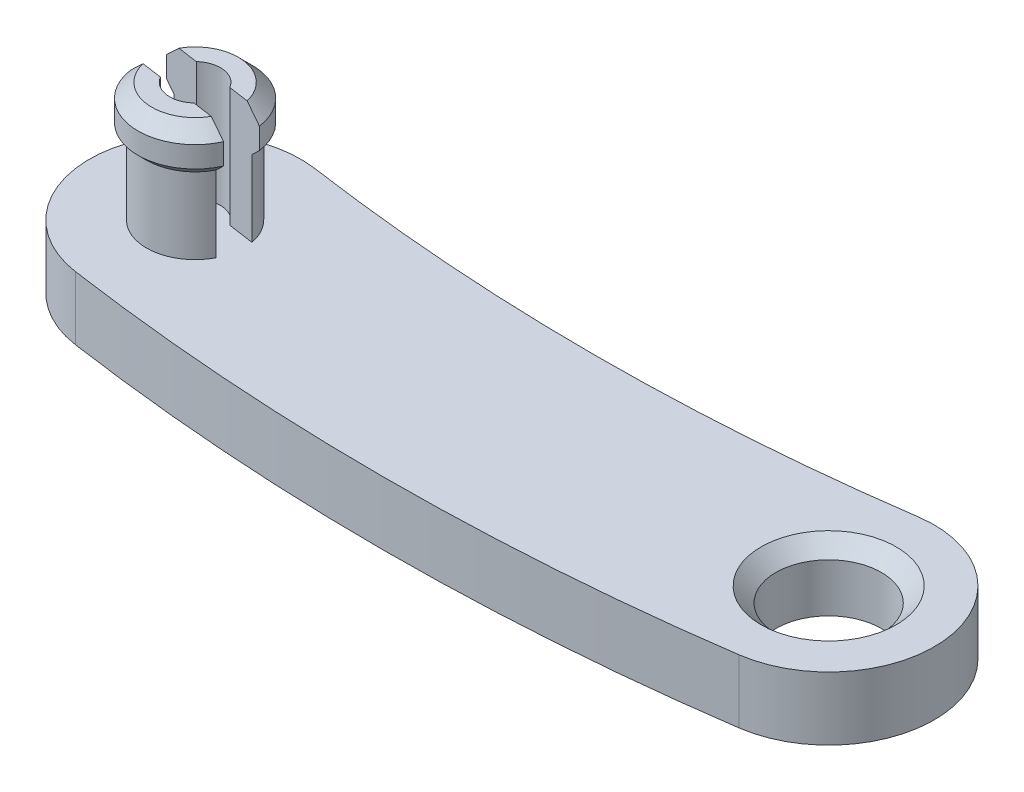
from build123d import *

# Parameters (mm, degrees)
SKETCH1_R           = 5
BOSS_EXTRUDE1_DEPTH = 3
SKETCH2_R           = 2.5
CUT_EXTRUDE1_DEPTH  = 3
CHAMFER1_SIZE       = 0.7
SKETCH3_R           = 2.3
BOSS_EXTRUDE2_DEPTH = 4
SKETCH4_R           = 2.7
BOSS_EXTRUDE3_DEPTH = 1
CHAMFER2_SIZE       = 0.4
SKETCH5_R           = 2.05
BOSS_EXTRUDE4_DEPTH = 0.65
CHAMFER3_SIZE       = 0.65
CUT_EXTRUDE2_REACH  = 38.562
SKETCH7_R           = 1.2
CUT_EXTRUDE3_DEPTH  = 5.65


with BuildPart() as part:
    # Sketch1 → Boss-Extrude1 (new body)
    with BuildSketch(Plane(origin=(0, 0, 0), x_dir=(1, 0, 0), z_dir=(0, 1, 0))):
        with Locations((-30, 0)):
            Circle(SKETCH1_R)
        with BuildLine():
            ThreePointArc((0.714285714, -4.948716593), (-4.948716593, -0.714285714), (-0.714285714, 4.948716593))
            ThreePointArc((-0.714285714, 4.948716593), (-15, 3.923048454), (-29.285714286, 4.948716593))
            ThreePointArc((-29.285714286, 4.948716593), (-26.22035527, 3.273268354), (-25, 0))
            ThreePointArc((-25, 0), (-26.726731646, -3.77964473), (-30.714285714, -4.948716593))
            ThreePointArc((-30.714285714, -4.948716593), (-15, -6.076951546), (0.714285714, -4.948716593))
        make_face()
        Circle(SKETCH1_R)
    extrude(amount=-BOSS_EXTRUDE1_DEPTH)

    # Sketch2 → Cut-Extrude1 (cut)
    with BuildSketch(Plane(origin=(0, 0, 0), x_dir=(1, 0, 0), z_dir=(0, 1, 0))):
        with Locations(Location((0, 0, 0), (0, 0, 270))):
            Circle(SKETCH2_R)
    extrude(amount=-CUT_EXTRUDE1_DEPTH, mode=Mode.SUBTRACT)

    # Chamfer1
    chamfer1_edges = [part.edges().sort_by_distance(p)[0] for p in [
        (0, 0, -2.5),
    ]]
    chamfer(chamfer1_edges, length=CHAMFER1_SIZE)

    # Sketch3 → Boss-Extrude2 (add)
    with BuildSketch(Plane(origin=(0, 0, 0), x_dir=(1, 0, 0), z_dir=(0, 1, 0))):
        with Locations(Location((-30, 0, 0), (0, 0, 270))):
            Circle(SKETCH3_R)
    extrude(amount=BOSS_EXTRUDE2_DEPTH)

    # Sketch4 → Boss-Extrude3 (add)
    with BuildSketch(Plane(origin=(0, 4, 0), x_dir=(1, 0, 0), z_dir=(0, 1, 0))):
        with Locations(Location((-30, 0, 0), (0, 0, 270))):
            Circle(SKETCH4_R)
    extrude(amount=BOSS_EXTRUDE3_DEPTH)

    # Chamfer2
    chamfer2_edges = [part.edges().sort_by_distance(p)[0] for p in [
        (-30, 4, -2.3),
    ]]
    chamfer(chamfer2_edges, length=CHAMFER2_SIZE - 0.0001)  # a hair under: the kernel refuses the full size

    # Sketch5 → Boss-Extrude4 (add)
    with BuildSketch(Plane(origin=(0, 5, 0), x_dir=(1, 0, 0), z_dir=(0, 1, 0))):
        with Locations(Location((-30, 0, 0), (0, 0, 270))):
            Circle(SKETCH5_R)
    extrude(amount=BOSS_EXTRUDE4_DEPTH)

    # Chamfer3
    chamfer3_edges = [part.edges().sort_by_distance(p)[0] for p in [
        (-30, 5, -2.05),
    ]]
    chamfer(chamfer3_edges, length=CHAMFER3_SIZE - 0.0001)  # a hair under: the kernel refuses the full size

    # Cut-Extrude2: up to this face of the body (flat: up to its plane)
    cut_extrude2_end = Plane(part.part.faces().sort_by_distance((-15.705189874, 0, 0.65316875))[0])
    # Sketch6 → Cut-Extrude2 (cut, up to the picked face)
    with BuildSketch(Plane(origin=(0, 5.65, 0), x_dir=(1, 0, 0), z_dir=(0, 1, 0)), mode=Mode.PRIVATE) as cut_extrude2_sk1:
        with BuildLine():
            ThreePointArc((-34.78558394, 1.448511772), (-34.948716593, 0.714285714), (-34.999869654, -0.036103206))
            Line((-34.999869654, -0.036103206), (-31.995452759, -0.469753431))
            ThreePointArc((-31.995452759, -0.469753431), (-32.028973803, 0.292857143), (-31.781167045, 1.014861547))
            Line((-31.781167045, 1.014861547), (-34.78558394, 1.448511772))
        make_face()
    cut_extrude2_tool1 = split(extrude(cut_extrude2_sk1.sketch, amount=-CUT_EXTRUDE2_REACH, mode=Mode.PRIVATE), bisect_by=cut_extrude2_end, keep=Keep.BOTH, mode=Mode.PRIVATE)
    # Sketch6 → Cut-Extrude2 (cut, up to the picked face)
    with BuildSketch(Plane(origin=(0, 5.65, 0), x_dir=(1, 0, 0), z_dir=(0, 1, 0)), mode=Mode.PRIVATE) as cut_extrude2_sk2:
        with BuildLine():
            Line((-28.218832955, -1.014861547), (-25.21441606, -1.448511772))
            ThreePointArc((-25.21441606, -1.448511772), (-25.053894476, -0.732147629), (-25, 0))
            ThreePointArc((-25, 0), (-25.000032587, 0.01805172), (-25.000130346, 0.036103206))
            Line((-25.000130346, 0.036103206), (-28.004547241, 0.469753431))
            ThreePointArc((-28.004547241, 0.469753431), (-27.963682471, 0.236454905), (-27.95, 0))
            ThreePointArc((-27.95, 0), (-28.018347603, -0.524932166), (-28.218832955, -1.014861547))
        make_face()
    cut_extrude2_tool2 = split(extrude(cut_extrude2_sk2.sketch, amount=-CUT_EXTRUDE2_REACH, mode=Mode.PRIVATE), bisect_by=cut_extrude2_end, keep=Keep.BOTH, mode=Mode.PRIVATE)
    # Sketch6 → Cut-Extrude2 (cut, up to the picked face)
    with BuildSketch(Plane(origin=(0, 5.65, 0), x_dir=(1, 0, 0), z_dir=(0, 1, 0)), mode=Mode.PRIVATE) as cut_extrude2_sk3:
        with BuildLine():
            ThreePointArc((-31.781167045, 1.014861547), (-32.028973803, 0.292857143), (-31.995452759, -0.469753431))
            Line((-31.995452759, -0.469753431), (-28.218832955, -1.014861547))
            ThreePointArc((-28.218832955, -1.014861547), (-28.018347603, -0.524932166), (-27.95, 0))
            ThreePointArc((-27.95, 0), (-27.963682471, 0.236454905), (-28.004547241, 0.469753431))
            Line((-28.004547241, 0.469753431), (-31.781167045, 1.014861547))
        make_face()
    cut_extrude2_tool3 = split(extrude(cut_extrude2_sk3.sketch, amount=-CUT_EXTRUDE2_REACH, mode=Mode.PRIVATE), bisect_by=cut_extrude2_end, keep=Keep.BOTH, mode=Mode.PRIVATE)
    # Sketch6 → Cut-Extrude2 (cut, up to the picked face)
    with BuildSketch(Plane(origin=(0, 5.65, 0), x_dir=(1, 0, 0), z_dir=(0, 1, 0)), mode=Mode.PRIVATE) as cut_extrude2_sk4:
        with BuildLine():
            ThreePointArc((-34.78558394, 1.448511772), (-34.948716593, 0.714285714), (-34.999869654, -0.036103206))
            Line((-34.999869654, -0.036103206), (-31.995452759, -0.469753431))
            ThreePointArc((-31.995452759, -0.469753431), (-32.028973803, 0.292857143), (-31.781167045, 1.014861547))
            Line((-31.781167045, 1.014861547), (-34.78558394, 1.448511772))
        make_face()
    cut_extrude2_tool4 = split(extrude(cut_extrude2_sk4.sketch, amount=-CUT_EXTRUDE2_REACH, mode=Mode.PRIVATE), bisect_by=cut_extrude2_end, keep=Keep.BOTH, mode=Mode.PRIVATE)
    # Sketch6 → Cut-Extrude2 (cut, up to the picked face)
    with BuildSketch(Plane(origin=(0, 5.65, 0), x_dir=(1, 0, 0), z_dir=(0, 1, 0)), mode=Mode.PRIVATE) as cut_extrude2_sk5:
        with BuildLine():
            Line((-28.218832955, -1.014861547), (-25.21441606, -1.448511772))
            ThreePointArc((-25.21441606, -1.448511772), (-25.053894476, -0.732147629), (-25, 0))
            ThreePointArc((-25, 0), (-25.000032587, 0.01805172), (-25.000130346, 0.036103206))
            Line((-25.000130346, 0.036103206), (-28.004547241, 0.469753431))
            ThreePointArc((-28.004547241, 0.469753431), (-27.963682471, 0.236454905), (-27.95, 0))
            ThreePointArc((-27.95, 0), (-28.018347603, -0.524932166), (-28.218832955, -1.014861547))
        make_face()
    cut_extrude2_tool5 = split(extrude(cut_extrude2_sk5.sketch, amount=-CUT_EXTRUDE2_REACH, mode=Mode.PRIVATE), bisect_by=cut_extrude2_end, keep=Keep.BOTH, mode=Mode.PRIVATE)
    add(cut_extrude2_tool1.solids().sort_by(Axis((-33.456178, 5.65, -0.498856), (0, -1, 0)))[0], mode=Mode.SUBTRACT)
    add(cut_extrude2_tool2.solids().sort_by(Axis((-26.543822, 5.65, 0.498856), (0, -1, 0)))[0], mode=Mode.SUBTRACT)
    add(cut_extrude2_tool3.solids().sort_by(Axis((-30, 5.65, 0), (0, -1, 0)))[0], mode=Mode.SUBTRACT)
    add(cut_extrude2_tool4.solids().sort_by(Axis((-33.456178, 5.65, -0.498856), (0, -1, 0)))[0], mode=Mode.SUBTRACT)
    add(cut_extrude2_tool5.solids().sort_by(Axis((-26.543822, 5.65, 0.498856), (0, -1, 0)))[0], mode=Mode.SUBTRACT)

    # Sketch7 → Cut-Extrude3 (cut)
    with BuildSketch(Plane(origin=(0, 5.65, 0), x_dir=(1, 0, 0), z_dir=(0, 1, 0))):
        with Locations((-30, 0)):
            Circle(SKETCH7_R)
    extrude(amount=-CUT_EXTRUDE3_DEPTH, mode=Mode.SUBTRACT)


solid = part.part
